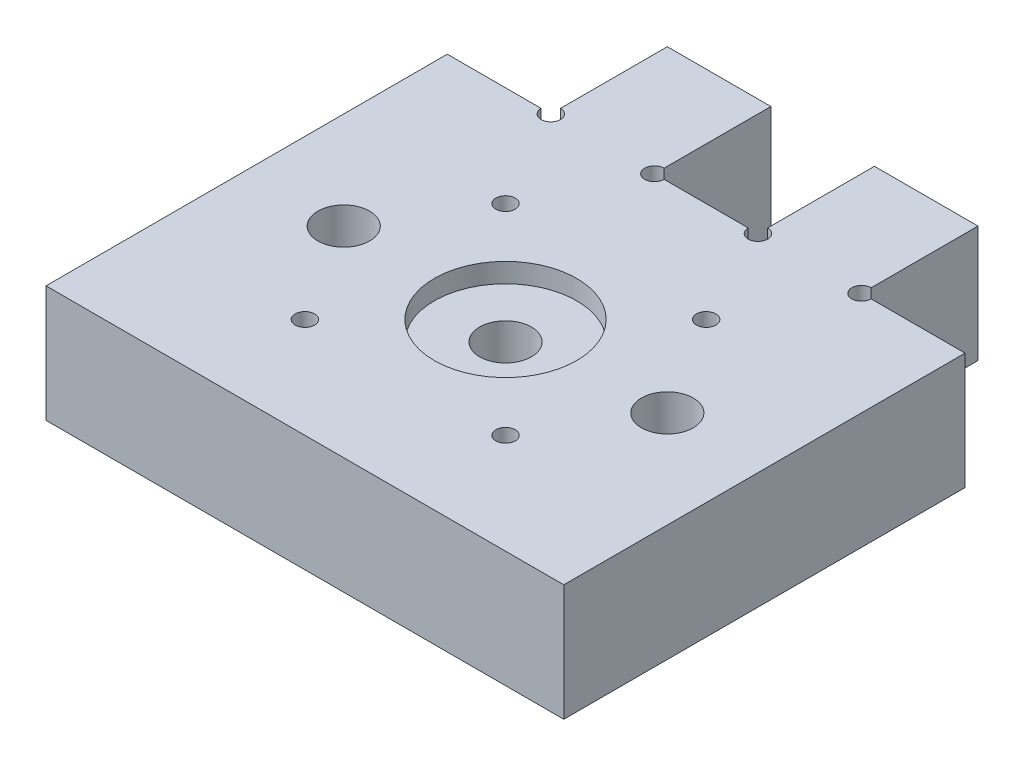
from build123d import *

# Parameters (mm, degrees)
SKETCH1_R           = 4
SKETCH1_R_2         = 1.5
BOSS_EXTRUDE1_DEPTH = 18
SKETCH2_R           = 11
CUT_EXTRUDE1_DEPTH  = 3
SKETCH3_R           = 1.5
CUT_EXTRUDE2_DEPTH  = 66.76473219


with BuildPart() as part:
    # Sketch1 → Boss-Extrude1 (new body)
    with BuildSketch(Plane(origin=(0, 0, 0), x_dir=(1, 0, 0), z_dir=(0, 1, 0))):
        Polygon((-40, 31), (-24, 31), (-24, 49), (-8, 49), (-8, 31), (8, 31), (8, 49), (24, 49), (24, 31), (40, 31), (40, -31), (-40, -31), align=None)
        Circle(SKETCH1_R, mode=Mode.SUBTRACT)
        with Locations((15.5, 15.5)):
            Circle(SKETCH1_R_2, mode=Mode.SUBTRACT)
        with Locations((-15.5, 15.5)):
            Circle(SKETCH1_R_2, mode=Mode.SUBTRACT)
        with Locations((-15.5, -15.5)):
            Circle(SKETCH1_R_2, mode=Mode.SUBTRACT)
        with Locations((15.5, -15.5)):
            Circle(SKETCH1_R_2, mode=Mode.SUBTRACT)
        with Locations((25, 0)):
            Circle(SKETCH1_R, mode=Mode.SUBTRACT)
        with Locations((-25, 0)):
            Circle(SKETCH1_R, mode=Mode.SUBTRACT)
    extrude(amount=BOSS_EXTRUDE1_DEPTH)

    # Sketch2 → Cut-Extrude1 (cut)
    with BuildSketch(Plane(origin=(0, 18, 0), x_dir=(1, 0, 0), z_dir=(0, 1, 0))):
        Circle(SKETCH2_R)
    extrude(amount=-CUT_EXTRUDE1_DEPTH, mode=Mode.SUBTRACT)

    # Sketch3 → Cut-Extrude2 (cut, through all)
    with BuildSketch(Plane(origin=(0, 18, 0), x_dir=(1, 0, 0), z_dir=(0, 1, 0))):
        with Locations((-24, 31)):
            Circle(SKETCH3_R)
        with Locations((-8, 31)):
            Circle(SKETCH3_R)
        with Locations((8, 31)):
            Circle(SKETCH3_R)
        with Locations((24, 31)):
            Circle(SKETCH3_R)
    extrude(amount=-CUT_EXTRUDE2_DEPTH, mode=Mode.SUBTRACT)


solid = part.part
